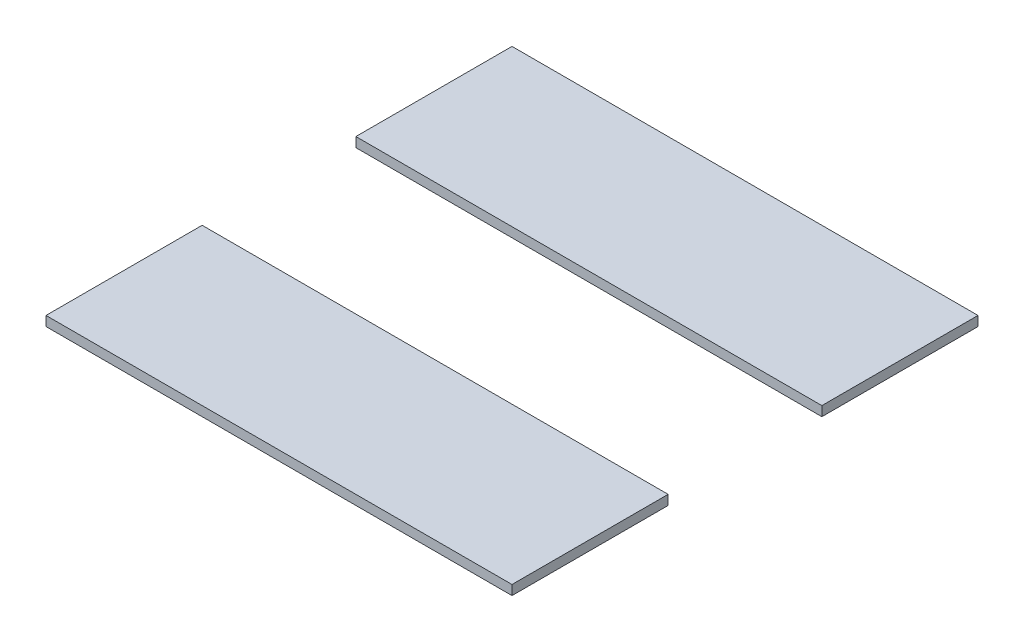
from build123d import *

# Parameters (mm, degrees)
SKETCH1_W           = 4908.55
SKETCH1_H           = 4908.55
BOSS_EXTRUDE1_DEPTH = 101.6
SKETCH2_W           = 4908.55
SKETCH2_H           = 1619.25
CUT_EXTRUDE1_DEPTH  = 3473.355700566


with BuildPart() as part:
    # Sketch1 → Boss-Extrude1 (new body)
    with BuildSketch(Plane(origin=(0, 0, 0), x_dir=(1, 0, 0), z_dir=(0, 1, 0))):
        Rectangle(SKETCH1_W, SKETCH1_H)
    extrude(amount=BOSS_EXTRUDE1_DEPTH)

    # Sketch2 → Cut-Extrude1 (cut, through all)
    with BuildSketch(Plane(origin=(0, 101.6, 0), x_dir=(1, 0, 0), z_dir=(0, 1, 0))):
        Rectangle(SKETCH2_W, SKETCH2_H)
    extrude(amount=-CUT_EXTRUDE1_DEPTH, mode=Mode.SUBTRACT)


with BuildPart() as cut_extrude1_piece_1:
    # of the separate pieces the step leaves, piece 1, a body of its own (cut_extrude1_pieces)
    add(part.part.solids().sort_by_distance((-2454.275, 0, -2454.275))[0])


with BuildPart() as cut_extrude1_piece_2:
    # of the separate pieces the step leaves, piece 2, a body of its own (cut_extrude1_pieces)
    add(part.part.solids().sort_by_distance((-2454.275, 0, 2454.275))[0])


solid = Compound([cut_extrude1_piece_1.part, cut_extrude1_piece_2.part])
